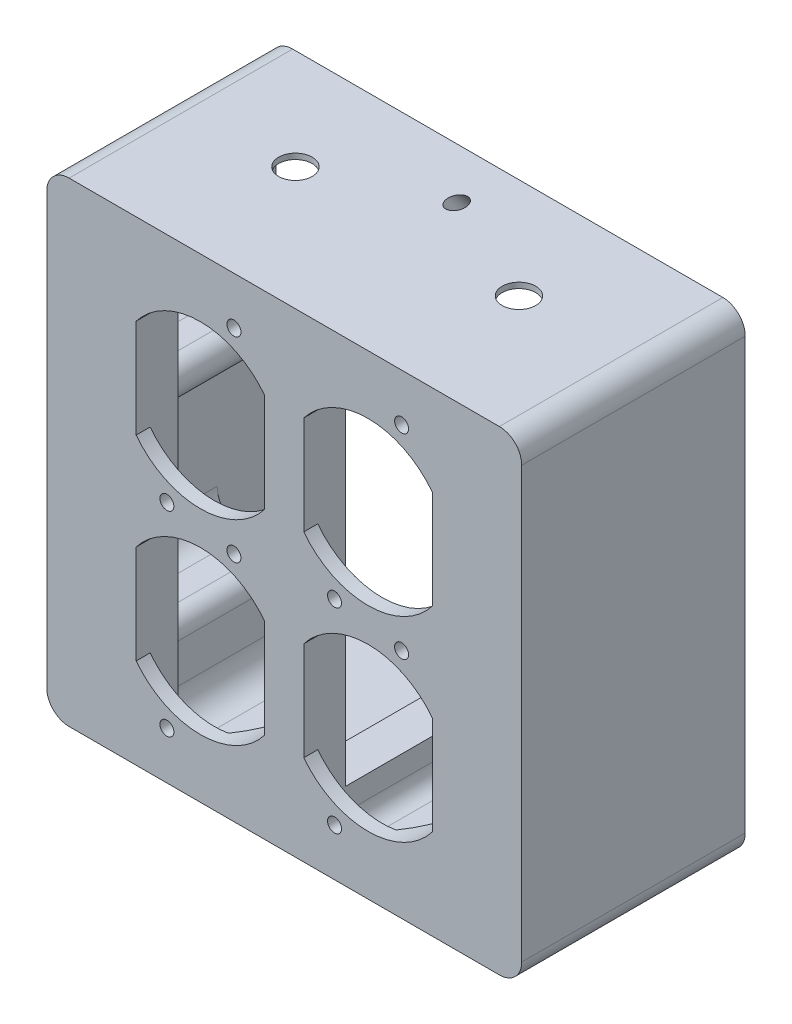
from build123d import *

# Parameters (mm, degrees)
SKETCH1_W               = 85
SKETCH1_H               = 85
BOSS_EXTRUDE1_DEPTH     = 40
CUT_EXTRUDE4_DEPTH      = 37.5
FILLET4_R               = 4
CUT_EXTRUDE1_DEPTH      = 73.197645391
SKETCH3_R               = 1.25
CUT_EXTRUDE6_DEPTH      = 73.197645391
LPATTERN1_COUNT         = 2
LPATTERN1_PITCH         = 35
LPATTERN1_COUNT_DIR2    = 2
LPATTERN1_PITCH_DIR2    = 30
BOSS_EXTRUDE7_START     = 5
SKETCH19_W              = 7
SKETCH19_H              = 83
BOSS_EXTRUDE7_DEPTH     = 5
CHAMFER1_START          = 32.5
CHAMFER1_DEPTH          = 5
CHAMFER1_START_2        = -41.5
CHAMFER1_2_DEPTH        = 83
CHAMFER1_3_DEPTH        = 67.831760866
CHAMFER1_START_3        = -26.331760866
CHAMFER1_4_DEPTH        = 67.831760866
BOSS_EXTRUDE8_START     = 22
BOSS_EXTRUDE8_DEPTH     = 22
SKETCH25_R              = 1.25
CUT_EXTRUDE10_DEPTH     = 5
BOSS_EXTRUDE6_DEPTH     = 40
SKETCH15_R              = 1.25
CUT_EXTRUDE7_DEPTH      = 10
CUT_EXTRUDE_THIN1_DEPTH = 2
MIRROR4_COPY_1_DEPTH    = 40
MIRROR4_COPY_2_SKETCH_R = 1.25
MIRROR4_COPY_2_DEPTH    = 10
MIRROR4_COPY_3_DEPTH    = 2
CUT_EXTRUDE8_REACH      = 105.108
SKETCH16_R              = 3
BOSS_EXTRUDE9_DEPTH     = 3.5
SKETCH27_R              = 1.5
CUT_EXTRUDE11_DEPTH     = 83.415732912
FILLET6_R               = 5
FILLET7_R               = 3


with BuildPart() as part:
    # Sketch1 → Boss-Extrude1 (new body)
    with BuildSketch(Plane.XY):
        Rectangle(SKETCH1_W, SKETCH1_H)
    extrude(amount=BOSS_EXTRUDE1_DEPTH)

    # Sketch8 → Cut-Extrude4 (cut)
    with BuildSketch(Plane(origin=(0, 0, 0), x_dir=(-1, 0, 0), z_dir=(0, 0, -1))):
        with BuildLine():
            Line((41.5, -38.5), (41.5, 38.5))
            ThreePointArc((41.5, 38.5), (40.621320344, 40.621320344), (38.5, 41.5))
            Line((38.5, 41.5), (-38.5, 41.5))
            ThreePointArc((-38.5, 41.5), (-40.621320344, 40.621320344), (-41.5, 38.5))
            Line((-41.5, 38.5), (-41.5, -38.5))
            ThreePointArc((-41.5, -38.5), (-40.621320344, -40.621320344), (-38.5, -41.5))
            Line((-38.5, -41.5), (38.5, -41.5))
            ThreePointArc((38.5, -41.5), (40.621320344, -40.621320344), (41.5, -38.5))
        make_face()
    extrude(amount=-CUT_EXTRUDE4_DEPTH, mode=Mode.SUBTRACT)

    # Fillet4
    fillet4_edges = [part.edges().sort_by_distance(p)[0] for p in [
        (42.5, -42.5, 20),
        (-42.5, -42.5, 20),
        (-42.5, 42.5, 20),
        (42.5, 42.5, 20),
    ]]
    fillet(fillet4_edges, radius=FILLET4_R)

    # Sketch2 → Cut-Extrude1 (cut, through all)
    with BuildSketch(Plane.XY.offset(40)):
        with BuildLine():
            Line((-26.5, 8.668239134), (-26.5, 26.331760866))
            ThreePointArc((-26.5, 26.331760866), (-15, 32), (-3.5, 26.331760866))
            Line((-3.5, 26.331760866), (-3.5, 8.668239134))
            ThreePointArc((-3.5, 8.668239134), (-15, 3), (-26.5, 8.668239134))
        make_face()
    cut_extrude1 = extrude(amount=-CUT_EXTRUDE1_DEPTH, mode=Mode.SUBTRACT)

    # Sketch3 → Cut-Extrude6 (cut, through all)
    with BuildSketch(Plane.XY.offset(40)):
        with Locations((-9, 34)):
            Circle(SKETCH3_R)
        with Locations((-21, 1)):
            Circle(SKETCH3_R)
    cut_extrude6 = extrude(amount=-CUT_EXTRUDE6_DEPTH, mode=Mode.SUBTRACT)

    # LPattern1: Cut-Extrude1, Cut-Extrude6 2 × 2
    with Locations(*[(j * LPATTERN1_PITCH_DIR2, -i * LPATTERN1_PITCH, 0) for i in range(LPATTERN1_COUNT) for j in range(LPATTERN1_COUNT_DIR2) if (i, j) != (0, 0)]):
        add(cut_extrude1, mode=Mode.SUBTRACT)
        add(cut_extrude6, mode=Mode.SUBTRACT)

    # Sketch19 → Boss-Extrude7 (add)
    with BuildSketch(Plane(origin=(0, 0, 37.5), x_dir=(-1, 0, 0), z_dir=(0, 0, -1)).offset(BOSS_EXTRUDE7_START)):
        with BuildLine():
            Line((-38.5, 41.5), (-26.5, 41.5))
            Line((-26.5, 41.5), (-26.5, -41.5))
            Line((-26.5, -41.5), (-38.5, -41.5))
            ThreePointArc((-38.5, -41.5), (-40.621320344, -40.621320344), (-41.5, -38.5))
            Line((-41.5, -38.5), (-41.5, 38.5))
            ThreePointArc((-41.5, 38.5), (-40.621320344, 40.621320344), (-38.5, 41.5))
        make_face()
        Rectangle(SKETCH19_W, SKETCH19_H)
        with BuildLine():
            Line((38.5, 41.5), (26.5, 41.5))
            Line((26.5, 41.5), (26.5, -41.5))
            Line((26.5, -41.5), (38.5, -41.5))
            ThreePointArc((38.5, -41.5), (40.621320344, -40.621320344), (41.5, -38.5))
            Line((41.5, -38.5), (41.5, 38.5))
            ThreePointArc((41.5, 38.5), (40.621320344, 40.621320344), (38.5, 41.5))
        make_face()
    extrude(amount=-BOSS_EXTRUDE7_DEPTH)

    # Chamfer1: read off the stored shape, not the designer's step
    # Chamfer1 outline → Chamfer1 (add)
    with BuildSketch(Plane.XY.offset(CHAMFER1_START)):
        with BuildLine():
            ThreePointArc((-26.5, 26.331760866), (-15, 32), (-3.5, 26.331760866))
            Line((-3.5, 26.331760866), (-3.5, 41.5))
            Line((-3.5, 41.5), (-26.5, 41.5))
            Line((-26.5, 41.5), (-26.5, 26.331760866))
        make_face()
        with BuildLine():
            Line((26.5, 41.5), (3.5, 41.5))
            Line((3.5, 41.5), (3.5, 26.331760866))
            ThreePointArc((3.5, 26.331760866), (15, 32), (26.5, 26.331760866))
            Line((26.5, 26.331760866), (26.5, 41.5))
        make_face()
        with BuildLine():
            Line((-3.5, -41.5), (-3.5, -26.331760866))
            ThreePointArc((-3.5, -26.331760866), (-15, -32), (-26.5, -26.331760866))
            Line((-26.5, -26.331760866), (-26.5, -41.5))
            Line((-26.5, -41.5), (-3.5, -41.5))
        make_face()
        with BuildLine():
            Line((3.5, -26.331760866), (3.5, -41.5))
            Line((3.5, -41.5), (26.5, -41.5))
            Line((26.5, -41.5), (26.5, -26.331760866))
            ThreePointArc((26.5, -26.331760866), (15, -32), (3.5, -26.331760866))
        make_face()
    extrude(amount=CHAMFER1_DEPTH)

    # Chamfer1 2 outline → Chamfer1 2 (cut)
    with BuildSketch(Plane(origin=(0, 0, 0), x_dir=(1, 0, 0), z_dir=(0, 1, 0)).offset(CHAMFER1_START_2)):
        Polygon((-17.5, -37.5), (-12.5, -37.5), (-7.5, -32.5), (-22.5, -32.5), align=None)
        Polygon((22.5, -32.5), (7.5, -32.5), (12.5, -37.5), (17.5, -37.5), align=None)
    extrude(amount=CHAMFER1_2_DEPTH, mode=Mode.SUBTRACT)

    # Chamfer1 3 outline → Chamfer1 3 (cut)
    with BuildSketch(Plane(origin=(0, 0, 0), x_dir=(1, 0, 0), z_dir=(0, 1, 0)).offset(CHAMFER1_START_2)):
        Polygon((7.5, -32.5), (3.5, -32.5), (3.5, -37.5), (12.5, -37.5), align=None)
        Polygon((-26.5, -37.5), (-17.5, -37.5), (-22.5, -32.5), (-26.5, -32.5), align=None)
    extrude(amount=CHAMFER1_3_DEPTH, mode=Mode.SUBTRACT)

    # Chamfer1 4 outline → Chamfer1 4 (cut)
    with BuildSketch(Plane(origin=(0, 0, 0), x_dir=(1, 0, 0), z_dir=(0, 1, 0)).offset(CHAMFER1_START_3)):
        Polygon((-7.5, -32.5), (-12.5, -37.5), (-3.5, -37.5), (-3.5, -32.5), align=None)
        Polygon((26.5, -32.5), (22.5, -32.5), (17.5, -37.5), (26.5, -37.5), align=None)
    extrude(amount=CHAMFER1_4_DEPTH, mode=Mode.SUBTRACT)

    # Sketch23 → Boss-Extrude8 (add)
    with BuildSketch(Plane(origin=(0, 0, 32.5), x_dir=(-1, 0, 0), z_dir=(0, 0, -1)).offset(BOSS_EXTRUDE8_START)):
        with BuildLine():
            Line((-38.5, -41.5), (-29, -41.5))
            Line((-29, -41.5), (-29, -29.5))
            ThreePointArc((-29, -29.5), (-29.878679656, -27.378679656), (-32, -26.5))
            Line((-32, -26.5), (-41.5, -26.5))
            Line((-41.5, -26.5), (-41.5, -38.5))
            ThreePointArc((-41.5, -38.5), (-40.621320344, -40.621320344), (-38.5, -41.5))
        make_face()
        with BuildLine():
            Line((-41.5, 12.5), (-32, 12.5))
            ThreePointArc((-32, 12.5), (-29, 9.5), (-32, 6.5))
            Line((-32, 6.5), (-41.5, 6.5))
            Line((-41.5, 6.5), (-41.5, 12.5))
        make_face()
    boss_extrude8 = extrude(amount=-BOSS_EXTRUDE8_DEPTH)

    # Sketch25 → Cut-Extrude10 (cut)
    with BuildSketch(Plane(origin=(0, 0, 10.5), x_dir=(-1, 0, 0), z_dir=(0, 0, -1))):
        with Locations((-32, -29.5)):
            Circle(SKETCH25_R)
        with Locations((-32, 9.5)):
            Circle(SKETCH25_R)
    cut_extrude10 = extrude(amount=-CUT_EXTRUDE10_DEPTH, mode=Mode.SUBTRACT)

    # Mirror5: Boss-Extrude8, Cut-Extrude10 across plane
    add(boss_extrude8.mirror(Plane(origin=(0, 0, 0), x_dir=(0, 0, 1), z_dir=(1, 0, 0))))
    add(cut_extrude10.mirror(Plane(origin=(0, 0, 0), x_dir=(0, 0, 1), z_dir=(1, 0, 0))), mode=Mode.SUBTRACT)

    # Sketch14 → Boss-Extrude6 (add)
    with BuildSketch(Plane.XY.offset(40)):
        with BuildLine():
            Line((-38, 33.5), (-42.5, 33.5))
            Line((-42.5, 33.5), (-42.5, 38))
            ThreePointArc((-42.5, 38), (-41.181980515, 41.181980515), (-38, 42.5))
            Line((-38, 42.5), (-33.5, 42.5))
            Line((-33.5, 42.5), (-33.5, 38))
            ThreePointArc((-33.5, 38), (-34.818019485, 34.818019485), (-38, 33.5))
        make_face()
    boss_extrude6 = extrude(amount=-BOSS_EXTRUDE6_DEPTH)

    # Sketch15 → Cut-Extrude7 (cut)
    with BuildSketch(Plane(origin=(0, 0, 0), x_dir=(-1, 0, 0), z_dir=(0, 0, -1))):
        with Locations((38, 38)):
            Circle(SKETCH15_R)
    cut_extrude7 = extrude(amount=-CUT_EXTRUDE7_DEPTH, mode=Mode.SUBTRACT)

    # Sketch28 → Cut-Extrude-Thin1 (cut)
    with BuildSketch(Plane(origin=(0, 0, 0), x_dir=(-1, 0, 0), z_dir=(0, 0, -1))):
        with BuildLine():
            Line((33.5, 41.5), (38.5, 41.5))
            ThreePointArc((38.5, 41.5), (40.621320344, 40.621320344), (41.5, 38.5))
            Line((41.5, 38.5), (41.5, 33.5))
            Line((41.5, 33.5), (40.5, 33.5))
            Line((40.5, 33.5), (40.5, 38.5))
            ThreePointArc((40.5, 38.5), (39.914213562, 39.914213562), (38.5, 40.5))
            Line((38.5, 40.5), (33.5, 40.5))
            Line((33.5, 40.5), (33.5, 41.5))
        make_face()
    cut_extrude_thin1 = extrude(amount=-CUT_EXTRUDE_THIN1_DEPTH, mode=Mode.SUBTRACT)

    # Mirror3: Boss-Extrude6, Cut-Extrude7, Cut-Extrude-Thin1 across plane
    add(boss_extrude6.mirror(Plane(origin=(0, 0, 0), x_dir=(0, 0, 1), z_dir=(1, 0, 0))))
    add(cut_extrude7.mirror(Plane(origin=(0, 0, 0), x_dir=(0, 0, 1), z_dir=(1, 0, 0))), mode=Mode.SUBTRACT)
    add(cut_extrude_thin1.mirror(Plane(origin=(0, 0, 0), x_dir=(0, 0, 1), z_dir=(1, 0, 0))), mode=Mode.SUBTRACT)

    # Mirror4: Boss-Extrude6, Cut-Extrude7, Cut-Extrude-Thin1 across plane
    add(boss_extrude6.mirror(Plane.ZX))
    add(cut_extrude7.mirror(Plane.ZX), mode=Mode.SUBTRACT)
    add(cut_extrude_thin1.mirror(Plane.ZX), mode=Mode.SUBTRACT)

    # Mirror4 copy 1 sketch → Mirror4 copy 1 (add)
    with BuildSketch(Plane(origin=(0, 0, 40), x_dir=(-1, 0, 0), z_dir=(0, 0, 1))):
        with BuildLine():
            Line((-38, 33.5), (-42.5, 33.5))
            Line((-42.5, 33.5), (-42.5, 38))
            ThreePointArc((-42.5, 38), (-41.181980515, 41.181980515), (-38, 42.5))
            Line((-38, 42.5), (-33.5, 42.5))
            Line((-33.5, 42.5), (-33.5, 38))
            ThreePointArc((-33.5, 38), (-34.818019485, 34.818019485), (-38, 33.5))
        make_face()
    extrude(amount=-MIRROR4_COPY_1_DEPTH)

    # Mirror4 copy 2 sketch → Mirror4 copy 2 (cut)
    with BuildSketch(Plane(origin=(0, 0, 0), x_dir=(1, 0, 0), z_dir=(0, 0, -1))):
        with Locations((38, 38)):
            Circle(MIRROR4_COPY_2_SKETCH_R)
    extrude(amount=-MIRROR4_COPY_2_DEPTH, mode=Mode.SUBTRACT)

    # Mirror4 copy 3 sketch → Mirror4 copy 3 (cut)
    with BuildSketch(Plane(origin=(0, 0, 0), x_dir=(1, 0, 0), z_dir=(0, 0, -1))):
        with BuildLine():
            Line((33.5, 41.5), (38.5, 41.5))
            ThreePointArc((38.5, 41.5), (40.621320344, 40.621320344), (41.5, 38.5))
            Line((41.5, 38.5), (41.5, 33.5))
            Line((41.5, 33.5), (40.5, 33.5))
            Line((40.5, 33.5), (40.5, 38.5))
            ThreePointArc((40.5, 38.5), (39.914213562, 39.914213562), (38.5, 40.5))
            Line((38.5, 40.5), (33.5, 40.5))
            Line((33.5, 40.5), (33.5, 41.5))
        make_face()
    extrude(amount=-MIRROR4_COPY_3_DEPTH, mode=Mode.SUBTRACT)

    # Sketch16 → Cut-Extrude8 (cut, up to next)
    with BuildSketch(Plane(origin=(0, 42.5, 0), x_dir=(1, 0, 0), z_dir=(0, 1, 0)), mode=Mode.PRIVATE) as cut_extrude8_sk1:
        with Locations(Location((20, -18, 0), (0, 0, 270))):
            Circle(SKETCH16_R)
    cut_extrude8_tool1 = extrude(cut_extrude8_sk1.sketch, amount=-CUT_EXTRUDE8_REACH, mode=Mode.PRIVATE) & part.part
    # Sketch16 → Cut-Extrude8 (cut, up to next)
    with BuildSketch(Plane(origin=(0, 42.5, 0), x_dir=(1, 0, 0), z_dir=(0, 1, 0)), mode=Mode.PRIVATE) as cut_extrude8_sk2:
        with Locations(Location((-20, -18, 0), (0, 0, 270))):
            Circle(SKETCH16_R)
    cut_extrude8_tool2 = extrude(cut_extrude8_sk2.sketch, amount=-CUT_EXTRUDE8_REACH, mode=Mode.PRIVATE) & part.part
    add(cut_extrude8_tool1.solids().sort_by_distance((20, 42.5, 18))[0], mode=Mode.SUBTRACT)
    add(cut_extrude8_tool2.solids().sort_by_distance((-20, 42.5, 18))[0], mode=Mode.SUBTRACT)

    # Sketch26 → Boss-Extrude9 (add, symmetric)
    with BuildSketch(Plane(origin=(0, 0, 0), x_dir=(0, 0, -1), z_dir=(1, 0, 0))):
        Polygon((-40, -42.5), (0, -42.5), (-9.534028741, -34.5), (-40, -34.5), align=None)
    boss_extrude9 = extrude(amount=BOSS_EXTRUDE9_DEPTH, both=True)

    # Sketch27 → Cut-Extrude11 (cut, through all)
    with BuildSketch(Plane(origin=(0, -24.940023775, 20.927164752), x_dir=(1, 0, 0), z_dir=(0, 0.7660444431189819, -0.6427876096865347))):
        with Locations(Location((0, 20.317716191, 0), (0, 0, 270))):
            Circle(SKETCH27_R)
    cut_extrude11 = extrude(amount=-CUT_EXTRUDE11_DEPTH, mode=Mode.SUBTRACT)

    # Mirror6: Boss-Extrude9, Cut-Extrude11 across plane
    add(boss_extrude9.mirror(Plane.ZX))
    add(cut_extrude11.mirror(Plane.ZX), mode=Mode.SUBTRACT)

    # Fillet6
    fillet6_edges = [part.edges().sort_by_distance(p)[0] for p in [
        (41.5, 12.5, 21.5),
        (41.5, 6.5, 21.5),
        (29, -41.5, 21.5),
        (41.5, -26.5, 21.5),
        (-41.5, 12.5, 21.5),
        (-41.5, 6.5, 21.5),
        (-29, -41.5, 21.5),
        (-41.5, -26.5, 21.5),
    ]]
    fillet(fillet6_edges, radius=FILLET6_R)

    # Fillet7
    fillet7_edges = [part.edges().sort_by_distance(p)[0] for p in [
        (3.5, -41.5, 19.345876796),
        (-3.5, 41.5, 19.345876796),
        (-3.5, -41.5, 16.845876796),
        (3.5, 41.5, 16.845876796),
    ]]
    fillet(fillet7_edges, radius=FILLET7_R)


solid = part.part
